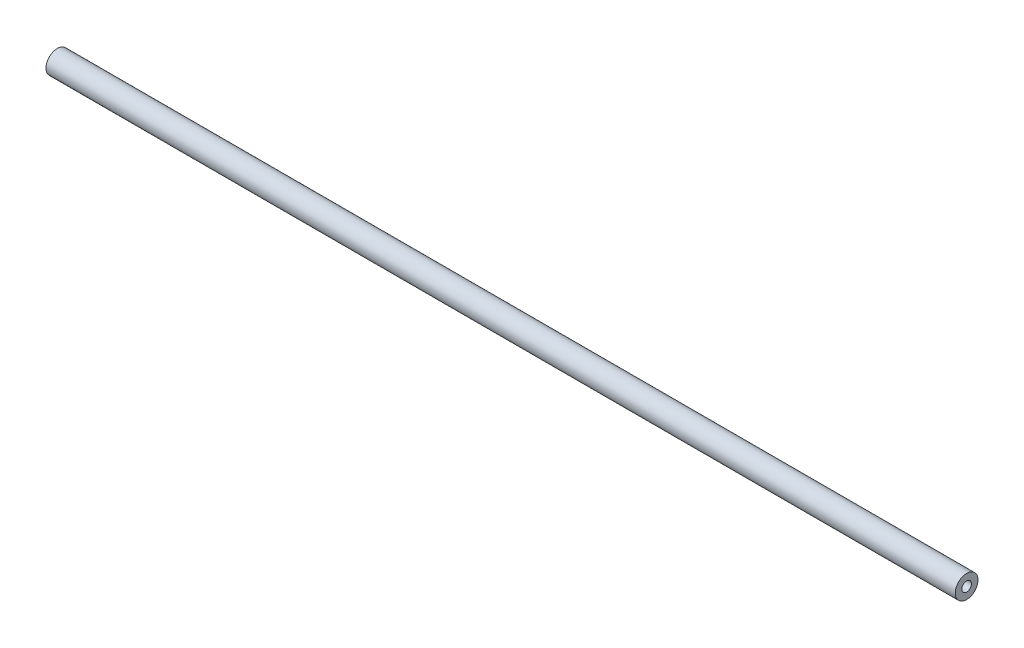
from build123d import *

# Parameters (mm, degrees)
SKETCH1_R                            = 4.7625
BOSS_EXTRUDE1_DEPTH                  = 190.5
F_10_32_TAPPED_HOLE1_D               = 4.0386
F_10_32_TAPPED_HOLE1_DEPTH           = 12.02944
F_10_32_TAPPED_HOLE1_TIP             = 1.213317848
F_10_32_TAPPED_HOLE1_ON_FACE_2_D     = 4.0386
F_10_32_TAPPED_HOLE1_ON_FACE_2_DEPTH = 12.02944
F_10_32_TAPPED_HOLE1_ON_FACE_2_TIP   = 1.213317848


with BuildPart() as part:
    # Sketch1 → Boss-Extrude1 (new, symmetric)
    with BuildSketch(Plane(origin=(0, 0, 0), x_dir=(0, 0, -1), z_dir=(1, 0, 0))):
        Circle(SKETCH1_R)
    extrude(amount=BOSS_EXTRUDE1_DEPTH, both=True)

    # #10-32 Tapped Hole1
    with Locations(Plane(origin=(190.5, 0, 0), x_dir=(0, 0, 1), z_dir=(1, 0, 0))):
        with Locations((0, 0)):
            Hole(F_10_32_TAPPED_HOLE1_D / 2, depth=F_10_32_TAPPED_HOLE1_DEPTH)
            with Locations((0, 0, -(F_10_32_TAPPED_HOLE1_DEPTH + F_10_32_TAPPED_HOLE1_TIP / 2))):  # 118° drill point
                Cone(0, F_10_32_TAPPED_HOLE1_D / 2, F_10_32_TAPPED_HOLE1_TIP, mode=Mode.SUBTRACT)

    # #10-32 Tapped Hole1 on face 2
    with Locations(Plane(origin=(-190.5, 0, 0), x_dir=(0, 0, -1), z_dir=(-1, 0, 0))):
        with Locations((0, 0)):
            Hole(F_10_32_TAPPED_HOLE1_ON_FACE_2_D / 2, depth=F_10_32_TAPPED_HOLE1_ON_FACE_2_DEPTH)
            with Locations((0, 0, -(F_10_32_TAPPED_HOLE1_ON_FACE_2_DEPTH + F_10_32_TAPPED_HOLE1_ON_FACE_2_TIP / 2))):  # 118° drill point
                Cone(0, F_10_32_TAPPED_HOLE1_ON_FACE_2_D / 2, F_10_32_TAPPED_HOLE1_ON_FACE_2_TIP, mode=Mode.SUBTRACT)


solid = part.part
